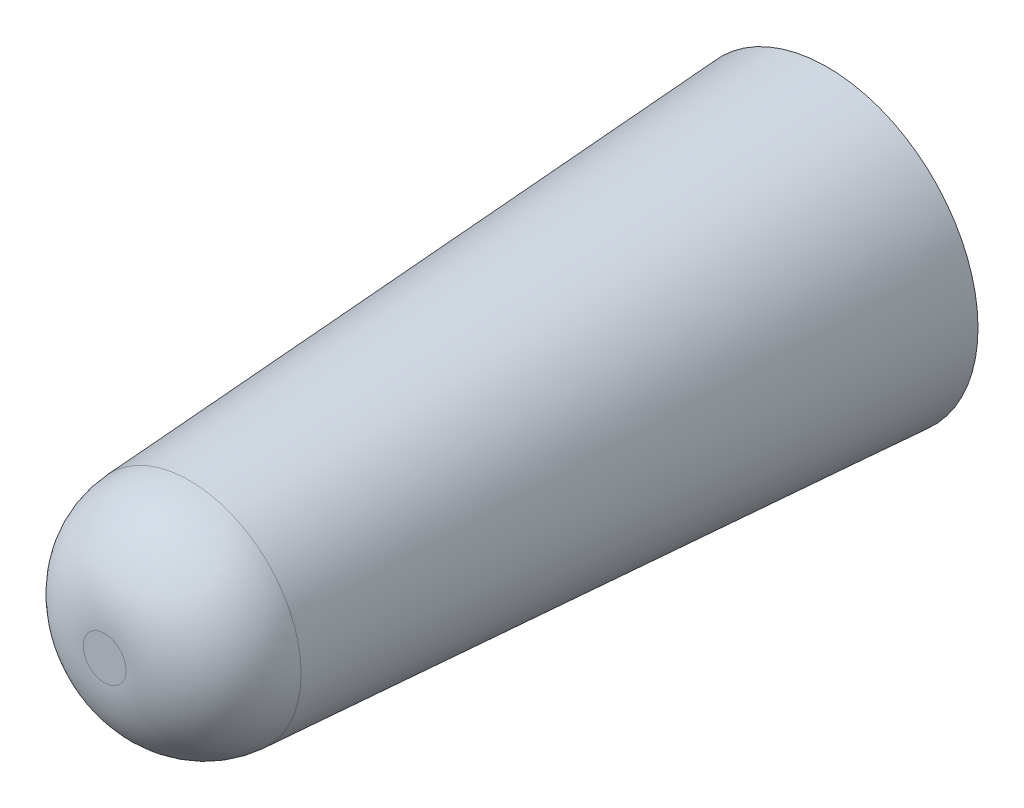
from build123d import *

# Parameters (mm, degrees)
SKETCH1_R           = 63.5
BOSS_EXTRUDE1_DEPTH = 304.8
BOSS_EXTRUDE1_TAPER = 3.5
FILLET2_R           = 38.1
SHELL2_T            = -1.5875


with BuildPart() as part:
    # Sketch1 → Boss-Extrude1 (new body)
    with BuildSketch(Plane.XY):
        with Locations((-76.2, 0)):
            Circle(SKETCH1_R)
    extrude(amount=BOSS_EXTRUDE1_DEPTH, taper=BOSS_EXTRUDE1_TAPER)

    # Fillet2
    fillet2_edges = [part.edges().sort_by_distance(p)[0] for p in [
        (-121.057633378, 0, 304.8),
    ]]
    fillet(fillet2_edges, radius=FILLET2_R)

    # Shell2
    shell2_openings = [part.faces().sort_by_distance(p)[0] for p in [
        (-76.2, 0, 0),
    ]]
    offset(amount=SHELL2_T, openings=shell2_openings, kind=Kind.INTERSECTION)


solid = part.part
